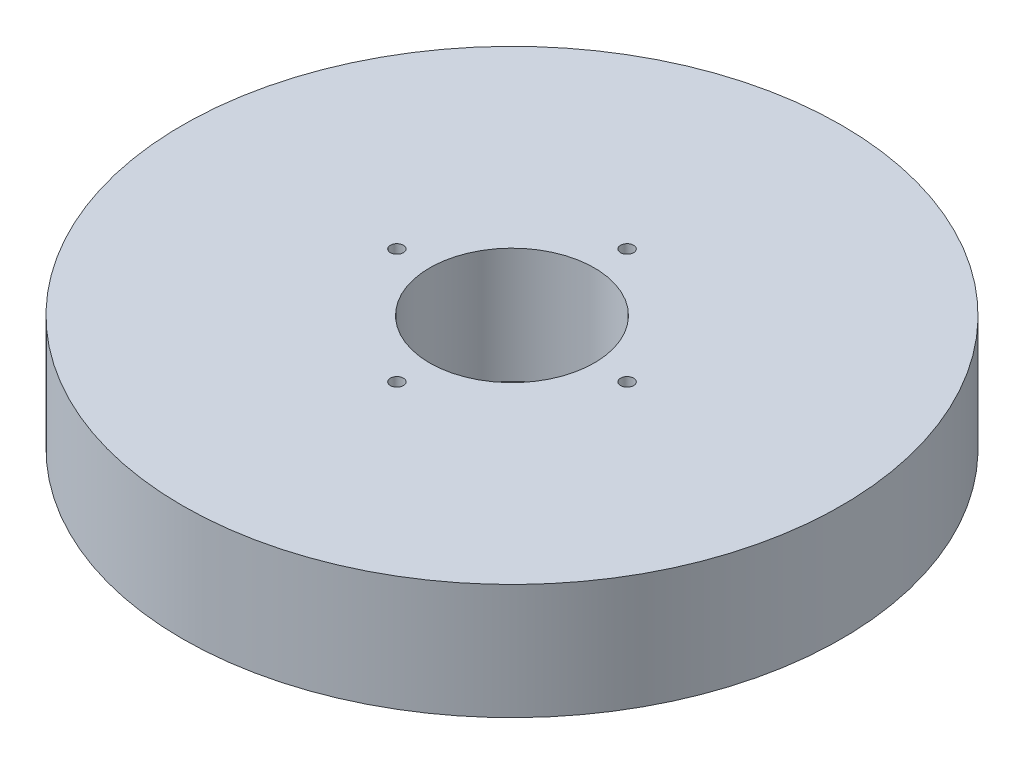
from build123d import *

# Parameters (mm, degrees)
SKETCH1_R           = 80
BOSS_EXTRUDE1_DEPTH = 28
SKETCH2_R           = 20
CUT_EXTRUDE1_DEPTH  = 117.550418275
SKETCH3_R           = 1.57781304
CUT_EXTRUDE2_DEPTH  = 22.368580383
CIRPATTERN1_COUNT   = 4


with BuildPart() as part:
    # Sketch1 → Boss-Extrude1 (new body)
    with BuildSketch(Plane(origin=(0, 0, 0), x_dir=(1, 0, 0), z_dir=(0, 1, 0))):
        Circle(SKETCH1_R)
    extrude(amount=BOSS_EXTRUDE1_DEPTH)

    # Sketch2 → Cut-Extrude1 (cut, through all)
    with BuildSketch(Plane(origin=(0, 0, 0), x_dir=(1, 0, 0), z_dir=(0, 1, 0))):
        Circle(SKETCH2_R)
    extrude(amount=CUT_EXTRUDE1_DEPTH, mode=Mode.SUBTRACT)

    # Sketch3 → Cut-Extrude2 (cut)
    with BuildSketch(Plane(origin=(0, 28, 0), x_dir=(1, 0, 0), z_dir=(0, 1, 0))):
        with Locations((-27.942004603, 0)):
            Circle(SKETCH3_R)
    cut_extrude2 = extrude(amount=-CUT_EXTRUDE2_DEPTH, mode=Mode.SUBTRACT)

    # CirPattern1: Cut-Extrude2 ×4 about axis
    cirpattern1_axis = Axis((0, 0, 0), (0, 1, 0))
    for i in range(1, CIRPATTERN1_COUNT):
        add(cut_extrude2.rotate(cirpattern1_axis, i * 360 / CIRPATTERN1_COUNT), mode=Mode.SUBTRACT)


solid = part.part
